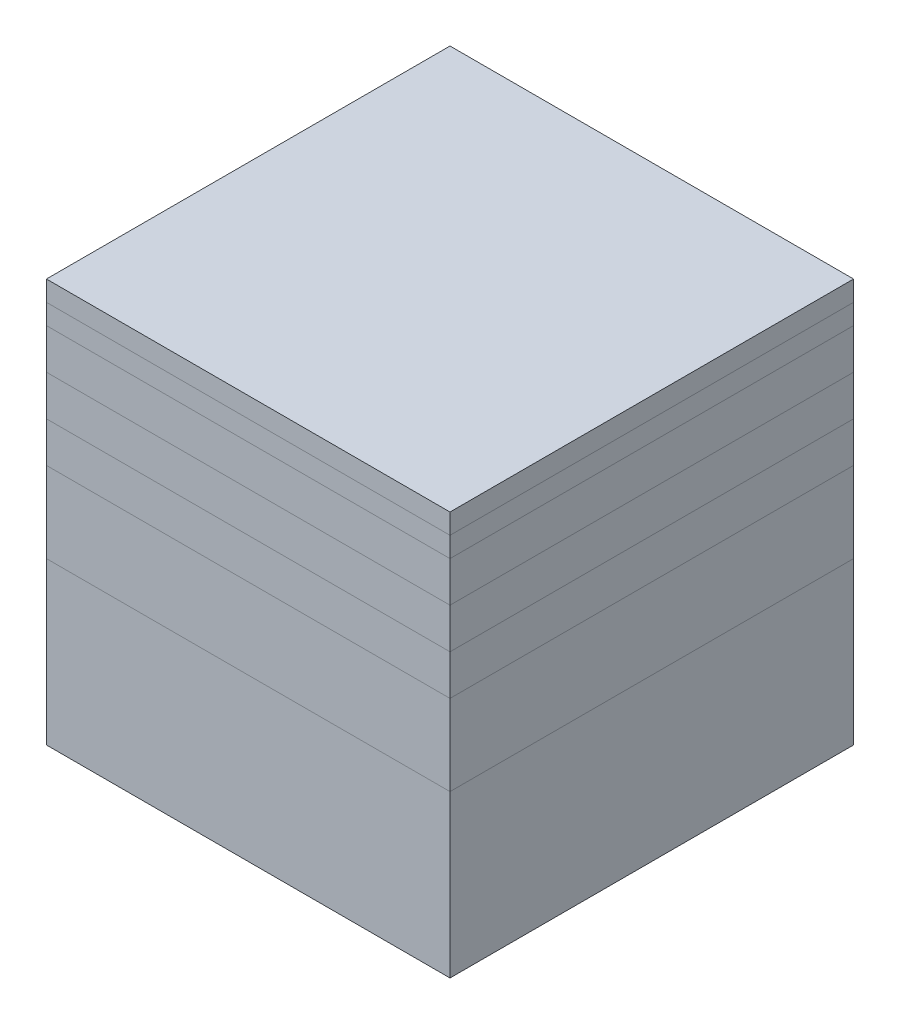
from build123d import *

# Parameters (mm, degrees)
SKETCH_1_W             = 50
SKETCH_1_H             = 50
EXTRUDE_1_DEPTH        = 5
PATTERN_LINEAR_1_COUNT = 9
PATTERN_LINEAR_1_PITCH = 5
SKETCH_2_W             = 50
SKETCH_2_H             = 50
EXTRUDE_2_DEPTH        = 2.5
SKETCH_3_W             = 50
SKETCH_3_H             = 50
EXTRUDE_3_DEPTH        = 2.5


with BuildPart() as part:
    # 草图1 → 凸台-拉伸1 (new body)
    with BuildSketch(Plane(origin=(0, 0, 0), x_dir=(1, 0, 0), z_dir=(0, 1, 0))):
        with Locations((25, -25)):
            Rectangle(SKETCH_1_W, SKETCH_1_H)
    extrude(amount=EXTRUDE_1_DEPTH)


with BuildPart() as pattern_linear_1_1:
    # 阵列(线性)1: pattern copy
    add(part.part.moved(Location(Vector(0, 1, 0) * (1 * PATTERN_LINEAR_1_PITCH))))


with BuildPart() as pattern_linear_1_2:
    # 阵列(线性)1: pattern copy
    add(part.part.moved(Location(Vector(0, 1, 0) * (2 * PATTERN_LINEAR_1_PITCH))))


with BuildPart() as pattern_linear_1_3:
    # 阵列(线性)1: pattern copy
    add(part.part.moved(Location(Vector(0, 1, 0) * (3 * PATTERN_LINEAR_1_PITCH))))


with BuildPart() as pattern_linear_1_4:
    # 阵列(线性)1: pattern copy
    add(part.part.moved(Location(Vector(0, 1, 0) * (4 * PATTERN_LINEAR_1_PITCH))))


with BuildPart() as pattern_linear_1_5:
    # 阵列(线性)1: pattern copy
    add(part.part.moved(Location(Vector(0, 1, 0) * (5 * PATTERN_LINEAR_1_PITCH))))

    # Combine 2: read off the stored shape, not the designer's step
    # Combine 2: union 阵列(线性)1_4
    add(pattern_linear_1_4.part)


with BuildPart() as pattern_linear_1_6:
    # 阵列(线性)1: pattern copy
    add(part.part.moved(Location(Vector(0, 1, 0) * (6 * PATTERN_LINEAR_1_PITCH))))


with BuildPart() as pattern_linear_1_7:
    # 阵列(线性)1: pattern copy
    add(part.part.moved(Location(Vector(0, 1, 0) * (7 * PATTERN_LINEAR_1_PITCH))))


with BuildPart() as pattern_linear_1_8:
    # 阵列(线性)1: pattern copy
    add(part.part.moved(Location(Vector(0, 1, 0) * (8 * PATTERN_LINEAR_1_PITCH))))


with BuildPart() as pattern_linear_1_2_1:
    add(pattern_linear_1_2.part)

    # Combine 1: read off the stored shape, not the designer's step
    # Combine 1: union part, 阵列(线性)1_3, 阵列(线性)1_1
    add(part.part)
    add(pattern_linear_1_3.part)
    add(pattern_linear_1_1.part)


with BuildPart() as body_6:
    # 草图2 → 凸台-拉伸2 (new body)
    with BuildSketch(Plane(origin=(0, 45, 0), x_dir=(1, 0, 0), z_dir=(0, 1, 0))):
        with Locations((25, -25)):
            Rectangle(SKETCH_2_W, SKETCH_2_H)
    extrude(amount=EXTRUDE_2_DEPTH)


with BuildPart() as body_7:
    # 草图3 → 凸台-拉伸3 (new body)
    with BuildSketch(Plane(origin=(0, 47.5, 0), x_dir=(1, 0, 0), z_dir=(0, 1, 0))):
        with Locations((25, -25)):
            Rectangle(SKETCH_3_W, SKETCH_3_H)
    extrude(amount=EXTRUDE_3_DEPTH)


solid = Compound([pattern_linear_1_5.part, pattern_linear_1_6.part, pattern_linear_1_7.part, pattern_linear_1_8.part, pattern_linear_1_2_1.part, body_6.part, body_7.part])
